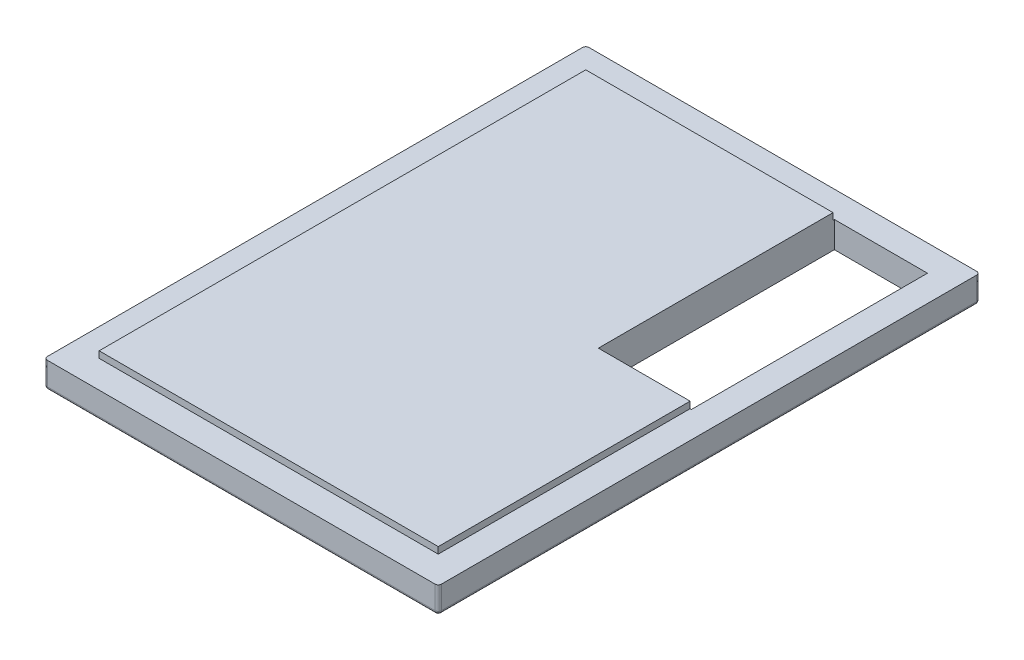
from build123d import *

# Parameters (mm, degrees)
SKETCH1_W           = 30.06
SKETCH1_H           = 41.31
BOSS_EXTRUDE1_DEPTH = 2.5
SKETCH2_OUTSIDE_W   = 42.29
SKETCH2_OUTSIDE_H   = 53.54
SKETCH2_OUTSIDE_W_2 = 25.86
SKETCH2_OUTSIDE_H_2 = 37.11
CUT_EXTRUDE1_DEPTH  = 0.5
FILLET1_R           = 0.25
SKETCH4_W           = 7.1
SKETCH4_H           = 18
CUT_EXTRUDE3_DEPTH  = 26.666708496


with BuildPart() as part:
    # Sketch1 → Boss-Extrude1 (new body)
    with BuildSketch(Plane(origin=(0, 0, 0), x_dir=(1, 0, 0), z_dir=(0, 1, 0))):
        Rectangle(SKETCH1_W, SKETCH1_H)
    extrude(amount=BOSS_EXTRUDE1_DEPTH)

    # Sketch2 outside → Cut-Extrude1 (cut)
    with BuildSketch(Plane(origin=(0, 2.5, 0), x_dir=(1, 0, 0), z_dir=(0, 1, 0))):
        Rectangle(SKETCH2_OUTSIDE_W, SKETCH2_OUTSIDE_H)
        Rectangle(SKETCH2_OUTSIDE_W_2, SKETCH2_OUTSIDE_H_2, mode=Mode.SUBTRACT)
    extrude(amount=-CUT_EXTRUDE1_DEPTH, mode=Mode.SUBTRACT)

    # Fillet1
    fillet1_edges = [part.edges().sort_by_distance(p)[0] for p in [
        (0, 0, -20.655),
        (-15.03, 1, -20.655),
        (-15.03, 0, 0),
        (15.03, 0, 0),
        (0, 0, 20.655),
        (-15.03, 1, 20.655),
        (15.03, 1, 20.655),
        (15.03, 1, -20.655),
    ]]
    fillet(fillet1_edges, radius=FILLET1_R)

    # Sketch4 → Cut-Extrude3 (cut, through all)
    with BuildSketch(Plane(origin=(0, 0, 0), x_dir=(-1, 0, 0), z_dir=(0, -1, 0))):
        with Locations((-9.48, 9.655)):
            Rectangle(SKETCH4_W, SKETCH4_H)
    extrude(amount=-CUT_EXTRUDE3_DEPTH, mode=Mode.SUBTRACT)


solid = part.part
